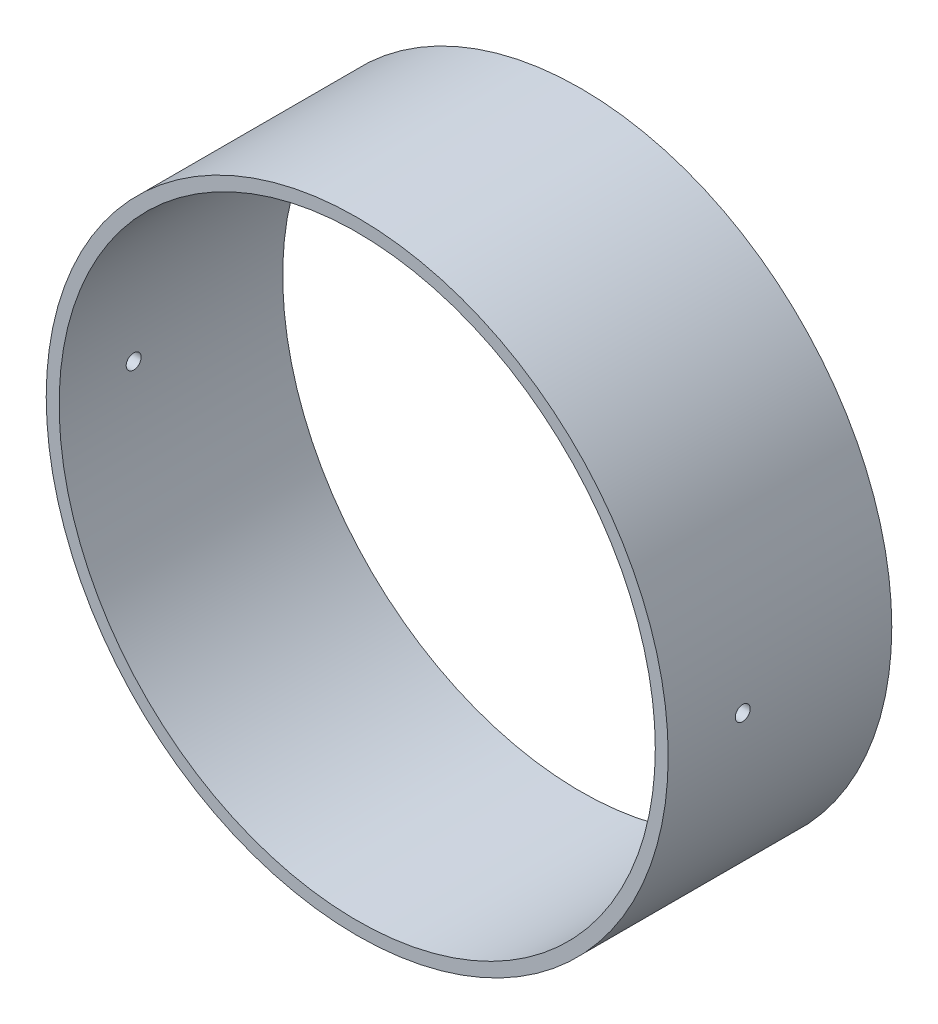
from build123d import *

# Parameters (mm, degrees)
SKETCH1_R           = 39.75
SKETCH1_R_2         = 38.1
BOSS_EXTRUDE1_DEPTH = 28.575
SKETCH2_R           = 0.9525
CUT_EXTRUDE1_DEPTH  = 94.364035501


with BuildPart() as part:
    # Sketch1 → Boss-Extrude1 (new body)
    with BuildSketch(Plane.XY):
        Circle(SKETCH1_R)
        Circle(SKETCH1_R_2, mode=Mode.SUBTRACT)
    extrude(amount=BOSS_EXTRUDE1_DEPTH)

    # Sketch2 → Cut-Extrude1 (cut, through all)
    with BuildSketch(Plane.ZY.offset(39.75)):
        with Locations((19.05, 0)):
            Circle(SKETCH2_R)
    extrude(amount=-CUT_EXTRUDE1_DEPTH, mode=Mode.SUBTRACT)


solid = part.part
